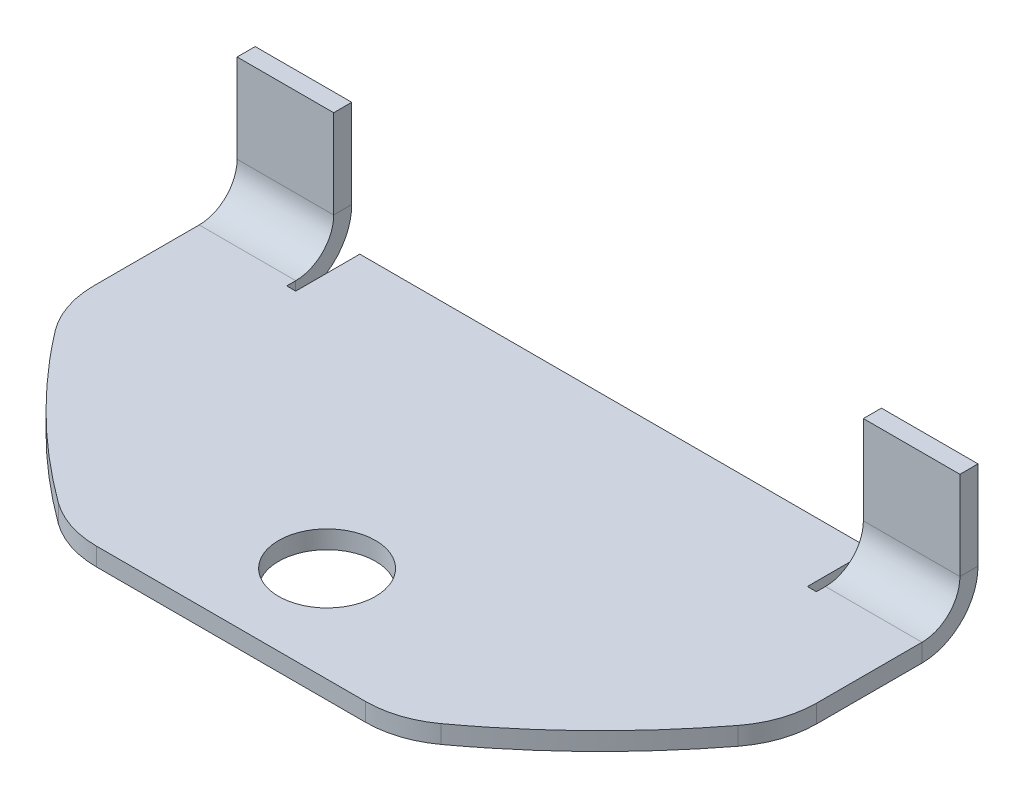
from build123d import *

# Parameters (mm, degrees)
SKETCH1_W                     = 190.5
SKETCH1_H                     = 101.6
BOSS_EXTRUDE1_DEPTH           = 1.5875
CONVERT_SOLID1_START          = -95.25
CONVERT_SOLID1_OUTLINE_W      = 3.175
CONVERT_SOLID1_OUTLINE_H      = 101.6
CONVERT_SOLID1_DEPTH          = 190.5
CUT_EXTRUDE5_START            = -4.7625
CUT_EXTRUDE5_DEPTH            = 4.7625
FILLET3_R                     = 25.4
FILLET4_R                     = 25.4
FILLET5_R                     = 25.4
FILLET6_R                     = 25.4
SKETCH30_R                    = 12.770921212
CUT_EXTRUDE6_DEPTH            = 38.1
SKETCH35_W                    = 139.601875342
SKETCH35_H                    = 6.35
CUT_EXTRUDE7_DEPTH            = 0.254
EDGE_FLANGE1_STRIP_W          = 39.05
EDGE_FLANGE1_STRIP_H          = 4.7625
EDGE_FLANGE1_STRIP_CUT_DEPTH  = 25.449062329
EDGE_FLANGE1_RELIEF_W         = 41.43125
EDGE_FLANGE1_RELIEF_H         = 2.38125
EDGE_FLANGE1_RELIEF_CUT_DEPTH = 4.7625
EDGE_FLANGE1_DEPTH            = 25.449062329
EDGE_FLANGE2_STRIP_W          = 39.05
EDGE_FLANGE2_STRIP_H          = 4.7625
EDGE_FLANGE2_STRIP_CUT_DEPTH  = 25.449062329
EDGE_FLANGE2_RELIEF_W         = 41.43125
EDGE_FLANGE2_RELIEF_H         = 2.38125
EDGE_FLANGE2_RELIEF_CUT_DEPTH = 4.7625
EDGE_FLANGE2_DEPTH            = 25.449062329


# Read off the part's stored shape, not the designer's step: Convert-Solid1, Cut-Extrude5
# Sheet-metal steps are written as plain solids
with BuildPart() as part:
    # Sketch1 → Boss-Extrude1 (new body)
    with BuildSketch(Plane(origin=(0, 0, 0), x_dir=(1, 0, 0), z_dir=(0, 1, 0))):
        Rectangle(SKETCH1_W, SKETCH1_H)
    extrude(amount=BOSS_EXTRUDE1_DEPTH)

    # Convert-Solid1 outline → Convert-Solid1 (add)
    with BuildSketch(Plane.YZ.offset(CONVERT_SOLID1_START)):
        with Locations((-1.5875, 0)):
            Rectangle(CONVERT_SOLID1_OUTLINE_W, CONVERT_SOLID1_OUTLINE_H)
    extrude(amount=CONVERT_SOLID1_DEPTH)

    # Cut-Extrude5 outline → Cut-Extrude5 (cut)
    with BuildSketch(Plane(origin=(0, 1.5875, 0), x_dir=(1, 0, 0), z_dir=(0, 1, 0)).offset(CUT_EXTRUDE5_START)):
        with BuildLine():
            Line((95.25, -50.8), (95.25, 0))
            add(Edge.make_bspline(
                [(95.25, 0), (74.104329576, -30.281671419), (43.45324244, -50.8)],
                knots=[0, 0, 0, 1, 1, 1], degree=2))
            Line((43.45324244, -50.8), (95.25, -50.8))
        make_face()
        with BuildLine():
            Line((-95.25, -50.8), (-43.45324244, -50.8))
            add(Edge.make_bspline(
                [(-43.45324244, -50.8), (-74.104329576, -30.281671419), (-95.25, 0)],
                knots=[0, 0, 0, 1, 1, 1], degree=2))
            Line((-95.25, 0), (-95.25, -50.8))
        make_face()
    extrude(amount=CUT_EXTRUDE5_DEPTH, mode=Mode.SUBTRACT)

    # Fillet3
    fillet3_edges = [part.edges().sort_by_distance(p)[0] for p in [
        (-95.25, -0.79375, 0),
    ]]
    fillet(fillet3_edges, radius=FILLET3_R)

    # Fillet4
    fillet4_edges = [part.edges().sort_by_distance(p)[0] for p in [
        (-43.45324244, -0.79375, 50.8),
    ]]
    fillet(fillet4_edges, radius=FILLET4_R)

    # Fillet5
    fillet5_edges = [part.edges().sort_by_distance(p)[0] for p in [
        (43.45324244, -0.79375, 50.8),
    ]]
    fillet(fillet5_edges, radius=FILLET5_R)

    # Fillet6
    fillet6_edges = [part.edges().sort_by_distance(p)[0] for p in [
        (95.25, -0.79375, 0),
    ]]
    fillet(fillet6_edges, radius=FILLET6_R)

    # Sketch30 → Cut-Extrude6 (cut)
    with BuildSketch(Plane(origin=(0, -3.175, 0), x_dir=(-1, 0, 0), z_dir=(0, -1, 0))):
        with Locations(Location((0, -25.504506424, 0), (0, 0, 90))):
            Circle(SKETCH30_R)
    extrude(amount=-CUT_EXTRUDE6_DEPTH, mode=Mode.SUBTRACT)

    # Sketch35 → Cut-Extrude7 (cut)
    with BuildSketch(Plane(origin=(0, 0, -50.8), x_dir=(-1, 0, 0), z_dir=(0, 0, -1))):
        Rectangle(SKETCH35_W, SKETCH35_H)
    extrude(amount=-CUT_EXTRUDE7_DEPTH, mode=Mode.SUBTRACT)

    # Edge-Flange1 strip (across the edge) → Edge-Flange1 strip cut (cut)
    with BuildSketch(Plane(origin=(95.25, 1.5875, -50.8), x_dir=(0, 0, 1), z_dir=(-1, 0, 0))):
        with Locations((-4.7625, -2.38125)):
            Rectangle(EDGE_FLANGE1_STRIP_W, EDGE_FLANGE1_STRIP_H)
    extrude(amount=EDGE_FLANGE1_STRIP_CUT_DEPTH, mode=Mode.SUBTRACT)

    # Edge-Flange1 relief (on the sheet) → Edge-Flange1 relief cut (cut)
    with BuildSketch(Plane(origin=(95.25, 1.5875, -36.0375), x_dir=(0, 0, 1), z_dir=(0, 1, 0))):
        with Locations((-18.334375, -26.639687329)):
            Rectangle(EDGE_FLANGE1_RELIEF_W, EDGE_FLANGE1_RELIEF_H)
    extrude(amount=-EDGE_FLANGE1_RELIEF_CUT_DEPTH, mode=Mode.SUBTRACT)

    # Edge-Flange1 section (across the edge) → Edge-Flange1 (add)
    with BuildSketch(Plane(origin=(95.25, 1.5875, -50.8), x_dir=(0, 0, 1), z_dir=(-1, 0, 0))):
        with BuildLine():
            Line((0, 10), (0, 33.3375))
            Line((0, 33.3375), (4.7625, 33.3375))
            Line((4.7625, 33.3375), (4.7625, 10))
            ThreePointArc((4.7625, 10), (7.691432188, 2.928932188), (14.7625, 0))
            Line((14.7625, 0), (14.7625, -4.7625))
            ThreePointArc((14.7625, -4.7625), (4.323836143, -0.438663857), (0, 10))
        make_face()
    extrude(amount=EDGE_FLANGE1_DEPTH)

    # Edge-Flange2 strip (across the edge) → Edge-Flange2 strip cut (cut)
    with BuildSketch(Plane(origin=(-69.800937671, 1.5875, -50.8), x_dir=(0, 0, 1), z_dir=(-1, 0, 0))):
        with Locations((-4.7625, -2.38125)):
            Rectangle(EDGE_FLANGE2_STRIP_W, EDGE_FLANGE2_STRIP_H)
    extrude(amount=EDGE_FLANGE2_STRIP_CUT_DEPTH, mode=Mode.SUBTRACT)

    # Edge-Flange2 relief (on the sheet) → Edge-Flange2 relief cut (cut)
    with BuildSketch(Plane(origin=(-69.800937671, 1.5875, -36.0375), x_dir=(0, 0, 1), z_dir=(0, 1, 0))):
        with Locations((-18.334375, 1.190625)):
            Rectangle(EDGE_FLANGE2_RELIEF_W, EDGE_FLANGE2_RELIEF_H)
    extrude(amount=-EDGE_FLANGE2_RELIEF_CUT_DEPTH, mode=Mode.SUBTRACT)

    # Edge-Flange2 section (across the edge) → Edge-Flange2 (add)
    with BuildSketch(Plane(origin=(-69.800937671, 1.5875, -50.8), x_dir=(0, 0, 1), z_dir=(-1, 0, 0))):
        with BuildLine():
            Line((0, 10), (0, 33.3375))
            Line((0, 33.3375), (4.7625, 33.3375))
            Line((4.7625, 33.3375), (4.7625, 10))
            ThreePointArc((4.7625, 10), (7.691432188, 2.928932188), (14.7625, 0))
            Line((14.7625, 0), (14.7625, -4.7625))
            ThreePointArc((14.7625, -4.7625), (4.323836143, -0.438663857), (0, 10))
        make_face()
    extrude(amount=EDGE_FLANGE2_DEPTH)


solid = part.part
